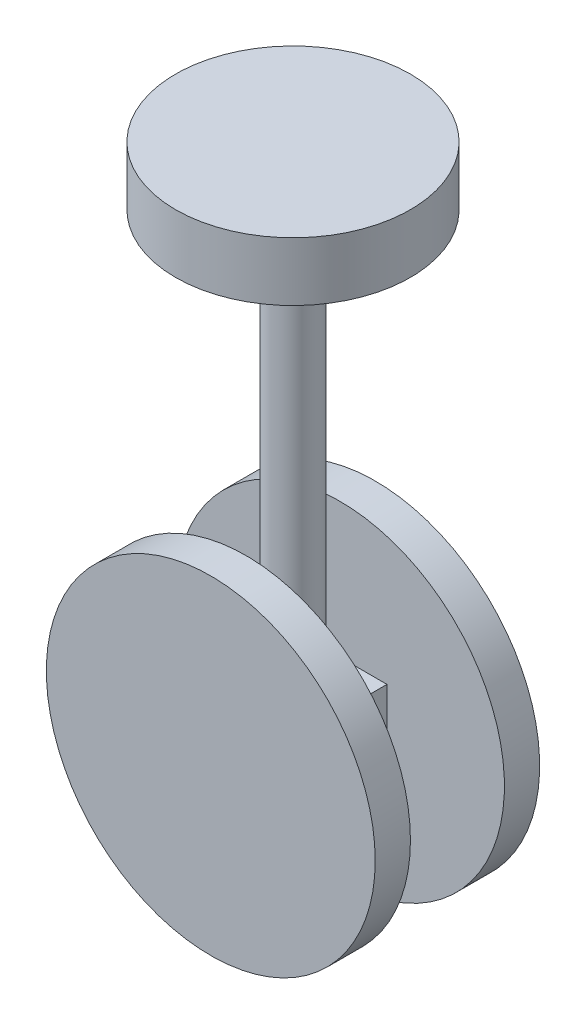
from build123d import *

# Parameters (mm, degrees)
SKETCH1_R           = 10
BOSS_EXTRUDE1_DEPTH = 5
SKETCH2_R           = 2
BOSS_EXTRUDE2_DEPTH = 35
SKETCH3_W           = 8
SKETCH3_H           = 8
BOSS_EXTRUDE3_DEPTH = 5
SKETCH5_R           = 14
BOSS_EXTRUDE4_DEPTH = 3
BOSS_EXTRUDE5_START = 3
SKETCH6_R           = 14
BOSS_EXTRUDE5_DEPTH = 3


with BuildPart() as part:
    # Sketch1 → Boss-Extrude1 (new body)
    with BuildSketch(Plane(origin=(0, 0, 0), x_dir=(1, 0, 0), z_dir=(0, 1, 0))):
        Circle(SKETCH1_R)
    extrude(amount=BOSS_EXTRUDE1_DEPTH)

    # Sketch2 → Boss-Extrude2 (add)
    with BuildSketch(Plane.XZ):
        Circle(SKETCH2_R)
    extrude(amount=BOSS_EXTRUDE2_DEPTH)

    # Sketch3 → Boss-Extrude3 (add)
    with BuildSketch(Plane.XZ.offset(35)):
        Rectangle(SKETCH3_W, SKETCH3_H)
    extrude(amount=BOSS_EXTRUDE3_DEPTH)

    # Sketch5 → Boss-Extrude4 (add)
    with BuildSketch(Plane(origin=(0, 0, -4), x_dir=(-1, 0, 0), z_dir=(0, 0, -1))):
        with Locations((0, -37.5)):
            Circle(SKETCH5_R)
    extrude(amount=BOSS_EXTRUDE4_DEPTH)

    # Sketch6 → Boss-Extrude5 (add)
    with BuildSketch(Plane.XY.offset(4).offset(BOSS_EXTRUDE5_START)):
        with Locations((0, -37.5)):
            Circle(SKETCH6_R)
    extrude(amount=-BOSS_EXTRUDE5_DEPTH)


solid = part.part
